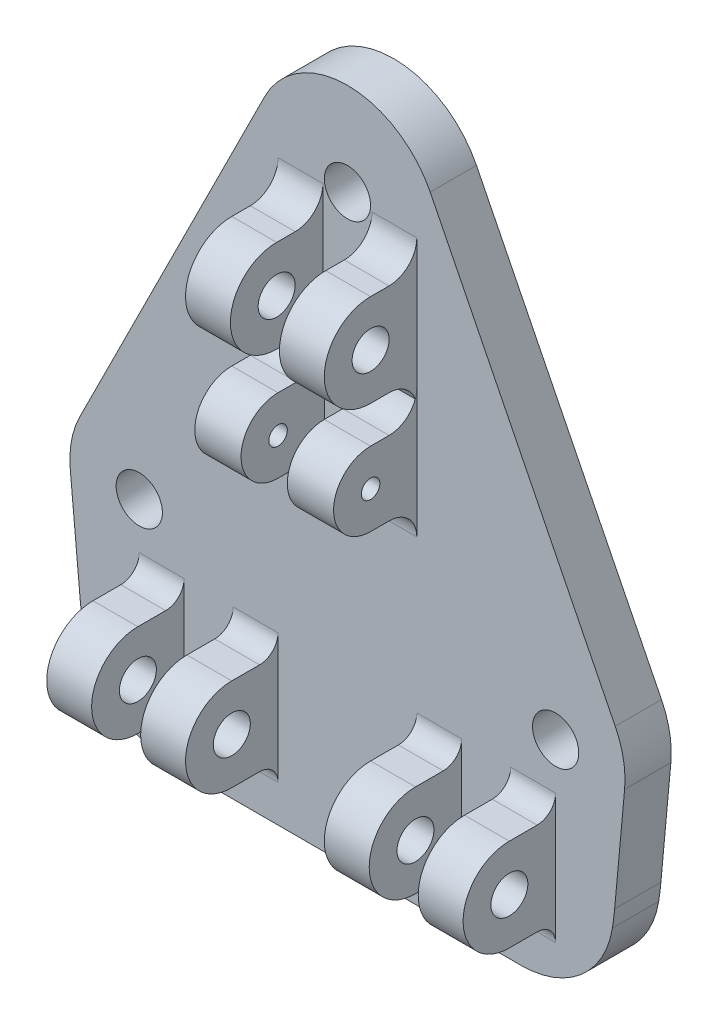
from build123d import *

# Parameters (mm, degrees)
BOSS_EXTRUDE1_DEPTH = 5
SKETCH2_R           = 2.5
CUT_EXTRUDE1_DEPTH  = 59.523499554
SKETCH3_R           = 1
BOSS_EXTRUDE2_DEPTH = 7.5
CUT_EXTRUDE3_REACH  = 71.82
SKETCH5_W           = 5
SKETCH5_H           = 18
FILLET1_R           = 3
SKETCH6_R           = 2
BOSS_EXTRUDE3_DEPTH = 7.5
SKETCH7_W           = 5.3
SKETCH7_H           = 20
CUT_EXTRUDE4_DEPTH  = 10
FILLET2_R           = 3
CUT_EXTRUDE5_DEPTH  = 60.160797831
FILLET4_R           = 10
SKETCH10_R          = 2
BOSS_EXTRUDE4_DEPTH = 22.5
SKETCH11_W          = 15
SKETCH11_H          = 20
SKETCH11_W_2        = 5.3
CUT_EXTRUDE6_DEPTH  = 10
FILLET5_R           = 2


with BuildPart() as part:
    # Sketch1 → Boss-Extrude1 (new body)
    with BuildSketch(Plane.XY):
        with BuildLine():
            Line((28.94427191, 4.472135955), (8.94427191, 44.472135955))
            ThreePointArc((8.94427191, 44.472135955), (0, 50), (-8.94427191, 44.472135955))
            Line((-8.94427191, 44.472135955), (-28.94427191, 4.472135955))
            ThreePointArc((-28.94427191, 4.472135955), (-29.827586533, 1.848930213), (-29.957965225, -0.915930449))
            Line((-29.957965225, -0.915930449), (-28.878099151, -12.656198302))
            ThreePointArc((-28.878099151, -12.656198302), (0, -39), (28.878099151, -12.656198302))
            Line((28.878099151, -12.656198302), (29.957965225, -0.915930449))
            ThreePointArc((29.957965225, -0.915930449), (29.827586533, 1.848930213), (28.94427191, 4.472135955))
        make_face()
    extrude(amount=BOSS_EXTRUDE1_DEPTH)

    # Sketch2 → Cut-Extrude1 (cut, through all)
    with BuildSketch(Plane.XY.offset(5)):
        with Locations((0, 40)):
            Circle(SKETCH2_R)
        with Locations((22.5, 0)):
            Circle(SKETCH2_R)
        with Locations((-22.5, 0)):
            Circle(SKETCH2_R)
    extrude(amount=-CUT_EXTRUDE1_DEPTH, mode=Mode.SUBTRACT)

    # Sketch3 → Boss-Extrude2 (add, symmetric)
    with BuildSketch(Plane(origin=(0, 0, 0), x_dir=(0, 0, -1), z_dir=(1, 0, 0))):
        with BuildLine():
            Line((-5, 22.472135955), (-5, 14.472135955))
            Line((-5, 14.472135955), (-10, 14.472135955))
            ThreePointArc((-10, 14.472135955), (-14, 18.472135955), (-10, 22.472135955))
            Line((-10, 22.472135955), (-5, 22.472135955))
        make_face()
        with Locations((-10, 18.472135955)):
            Circle(SKETCH3_R, mode=Mode.SUBTRACT)
    extrude(amount=BOSS_EXTRUDE2_DEPTH, both=True)

    # Cut-Extrude3: up to this face of the body (flat: up to its plane)
    cut_extrude3_end = Plane(part.part.faces().sort_by_distance((0, 14.472135955, 7.5))[0])
    # Sketch5 → Cut-Extrude3 (cut, up to the picked face)
    with BuildSketch(Plane(origin=(0, 22.472135955, 0), x_dir=(1, 0, 0), z_dir=(0, 1, 0)), mode=Mode.PRIVATE) as cut_extrude3_sk1:
        with Locations((0, -14)):
            Rectangle(SKETCH5_W, SKETCH5_H)
    cut_extrude3_tool1 = split(extrude(cut_extrude3_sk1.sketch, amount=-CUT_EXTRUDE3_REACH, mode=Mode.PRIVATE), bisect_by=cut_extrude3_end, keep=Keep.BOTH, mode=Mode.PRIVATE)
    add(cut_extrude3_tool1.solids().sort_by(Axis((0, 22.472136, 14), (0, -1, 0)))[0], mode=Mode.SUBTRACT)

    # Fillet1
    fillet1_edges = [part.edges().sort_by_distance(p)[0] for p in [
        (5, 22.472135955, 5),
        (5, 14.472135955, 5),
        (-5, 14.472135955, 5),
        (-5, 22.472135955, 5),
    ]]
    fillet(fillet1_edges, radius=FILLET1_R)

    # Sketch6 → Boss-Extrude3 (add, symmetric)
    with BuildSketch(Plane(origin=(0, 0, 0), x_dir=(0, 0, -1), z_dir=(1, 0, 0))):
        with BuildLine():
            Line((-5, 26.472135955), (-5, 36.472135955))
            Line((-5, 36.472135955), (-10, 36.472135955))
            ThreePointArc((-10, 36.472135955), (-15, 31.472135955), (-10, 26.472135955))
            Line((-10, 26.472135955), (-5, 26.472135955))
        make_face()
        with Locations((-10, 31.472135955)):
            Circle(SKETCH6_R, mode=Mode.SUBTRACT)
    extrude(amount=BOSS_EXTRUDE3_DEPTH, both=True)

    # Sketch7 → Cut-Extrude4 (cut)
    with BuildSketch(Plane(origin=(0, 36.472135955, 0), x_dir=(1, 0, 0), z_dir=(0, 1, 0))):
        with Locations((0, -15)):
            Rectangle(SKETCH7_W, SKETCH7_H)
    extrude(amount=-CUT_EXTRUDE4_DEPTH, mode=Mode.SUBTRACT)

    # Fillet2
    # the kernel refuses this fillet: 3 mm, written as the material it adds along each edge
    with BuildSketch(Plane(origin=(7.5, 26.472135955, 5), x_dir=(0, -1, 0), z_dir=(-1, 0, 0)), Plane(origin=(2.65, 36.472135955, 5), x_dir=(0, 1, 0), z_dir=(1, 0, 0)), Plane(origin=(-7.5, 36.472135955, 5), x_dir=(0, 1, 0), z_dir=(1, 0, 0)), Plane(origin=(-2.65, 26.472135955, 5), x_dir=(0, -1, 0), z_dir=(-1, 0, 0))) as fillet2_piece_1:
        with BuildLine():
            CenterArc((FILLET2_R, FILLET2_R), FILLET2_R, 180, 90)
            Line((0, FILLET2_R), (0, 0))
            Line((0, 0), (FILLET2_R, 0))
        make_face()
    extrude(amount=4.85)
    with BuildSketch(Plane(origin=(7.5, 26.472135955, 5), x_dir=(0, -1, 0), z_dir=(-1, 0, 0))) as fillet2_piece_2_section:
        with BuildLine():
            CenterArc((FILLET2_R, FILLET2_R), FILLET2_R, 180, 90)
            Line((0, FILLET2_R), (0, 0))
            Line((0, 0), (FILLET2_R, 0))
        make_face()
    fillet2_piece_2 = extrude(amount=12.35, mode=Mode.PRIVATE)
    fillet2_piece_2 = split(fillet2_piece_2, bisect_by=Plane(origin=(-2.65, 25.792950612, 5.679185343), z_dir=(-1, 0, 0)), keep=Keep.TOP, mode=Mode.PRIVATE)
    add(fillet2_piece_2)
    with BuildSketch(Plane(origin=(-4.85, 36.472135955, 5), x_dir=(0, 1, 0), z_dir=(1, 0, 0))) as fillet2_piece_3_section:
        with BuildLine():
            CenterArc((FILLET2_R, FILLET2_R), FILLET2_R, 180, 90)
            Line((0, FILLET2_R), (0, 0))
            Line((0, 0), (FILLET2_R, 0))
        make_face()
    fillet2_piece_3 = extrude(amount=12.35, mode=Mode.PRIVATE)
    fillet2_piece_3 = split(fillet2_piece_3, bisect_by=Plane(origin=(-2.65, 37.151321298, 5.679185343), z_dir=(-1, 0, 0)), keep=Keep.TOP, mode=Mode.PRIVATE)
    add(fillet2_piece_3)
    with BuildSketch(Plane(origin=(-7.5, 36.472135955, 5), x_dir=(0, 1, 0), z_dir=(1, 0, 0))) as fillet2_piece_4_section:
        with BuildLine():
            CenterArc((FILLET2_R, FILLET2_R), FILLET2_R, 180, 90)
            Line((0, FILLET2_R), (0, 0))
            Line((0, 0), (FILLET2_R, 0))
        make_face()
    fillet2_piece_4 = extrude(amount=12.35, mode=Mode.PRIVATE)
    fillet2_piece_4 = split(fillet2_piece_4, bisect_by=Plane(origin=(2.65, 37.151321298, 5.679185343), z_dir=(1, 0, 0)), keep=Keep.TOP, mode=Mode.PRIVATE)
    add(fillet2_piece_4)
    with BuildSketch(Plane(origin=(4.85, 26.472135955, 5), x_dir=(0, -1, 0), z_dir=(-1, 0, 0))) as fillet2_piece_5_section:
        with BuildLine():
            CenterArc((FILLET2_R, FILLET2_R), FILLET2_R, 180, 90)
            Line((0, FILLET2_R), (0, 0))
            Line((0, 0), (FILLET2_R, 0))
        make_face()
    fillet2_piece_5 = extrude(amount=12.35, mode=Mode.PRIVATE)
    fillet2_piece_5 = split(fillet2_piece_5, bisect_by=Plane(origin=(2.65, 25.792950612, 5.679185343), z_dir=(1, 0, 0)), keep=Keep.TOP, mode=Mode.PRIVATE)
    add(fillet2_piece_5)

    # Sketch8 → Cut-Extrude5 (cut, through all)
    with BuildSketch(Plane.XY.offset(5)):
        with BuildLine():
            Line((-25.922962794, -23), (25.922962794, -23))
            ThreePointArc((25.922962794, -23), (0, -39), (-25.922962794, -23))
        make_face()
    extrude(amount=-CUT_EXTRUDE5_DEPTH, mode=Mode.SUBTRACT)

    # Fillet4
    fillet4_edges = [part.edges().sort_by_distance(p)[0] for p in [
        (25.922962794, -23, 2.5),
        (-25.922962794, -23, 2.5),
    ]]
    fillet(fillet4_edges, radius=FILLET4_R)

    # Sketch10 → Boss-Extrude4 (add, symmetric)
    with BuildSketch(Plane(origin=(0, 0, 0), x_dir=(0, 0, -1), z_dir=(1, 0, 0))):
        with BuildLine():
            Line((-5, -17), (-10, -17))
            ThreePointArc((-10, -17), (-15, -12), (-10, -7))
            Line((-10, -7), (-5, -7))
            Line((-5, -7), (-5, -17))
        make_face()
        with Locations(Location((-10, -12, 0), (0, 0, 180))):
            Circle(SKETCH10_R, mode=Mode.SUBTRACT)
    extrude(amount=BOSS_EXTRUDE4_DEPTH, both=True)

    # Sketch11 → Cut-Extrude6 (cut)
    with BuildSketch(Plane.XZ.offset(17)):
        with Locations((0, 15)):
            Rectangle(SKETCH11_W, SKETCH11_H)
        with Locations((-15, 15)):
            Rectangle(SKETCH11_W_2, SKETCH11_H)
    cut_extrude6 = extrude(amount=-CUT_EXTRUDE6_DEPTH, mode=Mode.SUBTRACT)

    # Mirror1: Cut-Extrude6 across plane
    add(cut_extrude6.mirror(Plane(origin=(0, 0, 0), x_dir=(0, 0, 1), z_dir=(1, 0, 0))), mode=Mode.SUBTRACT)

    # Fillet5
    fillet5_edges = [part.edges().sort_by_distance(p)[0] for p in [
        (20.075, -17, 5),
        (20.075, -7, 5),
        (-9.925, -17, 5),
        (-20.075, -17, 5),
        (-9.925, -7, 5),
        (-20.075, -7, 5),
        (9.925, -7, 5),
        (9.925, -17, 5),
    ]]
    fillet(fillet5_edges, radius=FILLET5_R)


solid = part.part
